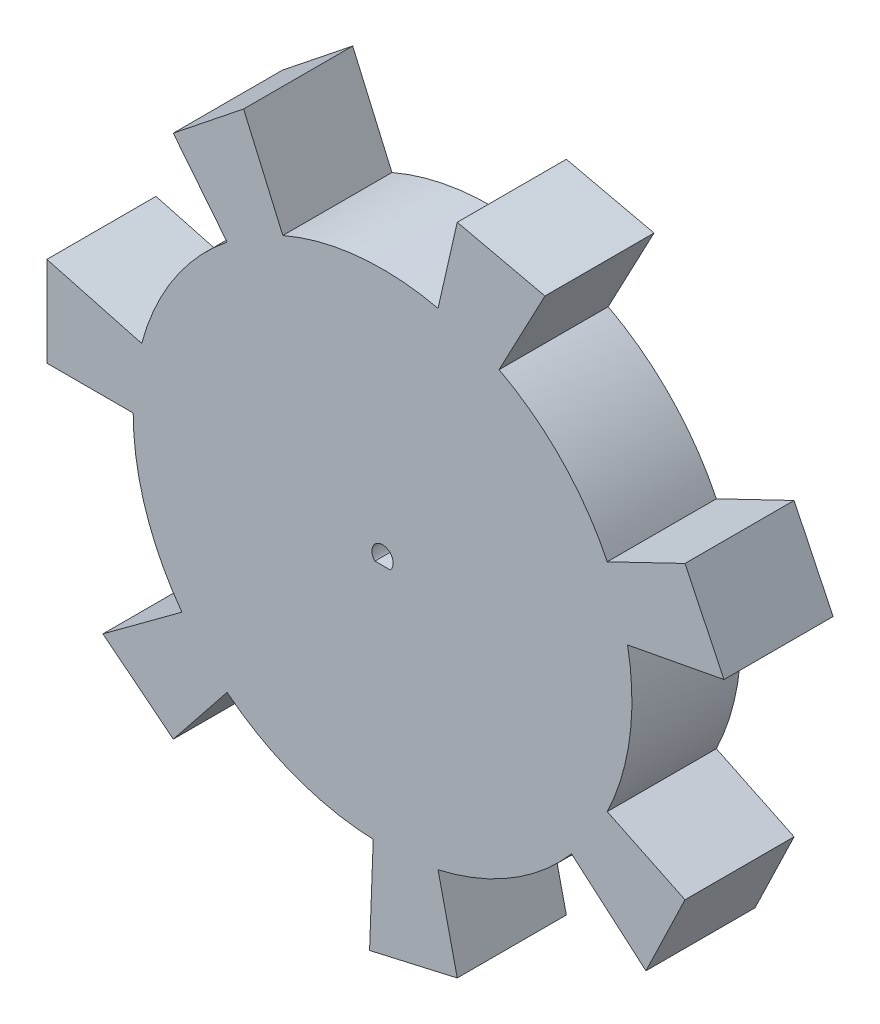
from build123d import *

# Parameters (mm, degrees)
SKETCH1_R           = 40
BOSS_EXTRUDE1_DEPTH = 17.5
SHELL1_OUTLINE_R    = 30
SHELL1_DEPTH        = 7.5
CUT_EXTRUDE1_DEPTH  = 17.5


# Read off the part's stored shape, not the designer's step: Shell1
with BuildPart() as part:
    # Sketch1 → Boss-Extrude1 (new body)
    with BuildSketch(Plane.XY):
        Circle(SKETCH1_R)
        with BuildLine():
            Line((-53.841642229, 0), (-40, 0))
            ThreePointArc((-40, 0), (-39.657794455, 5.221047689), (-38.637033052, 10.352761804))
            Line((-38.637033052, 10.352761804), (-53.841642229, 14.426824554))
            Line((-53.841642229, 14.426824554), (-53.841642229, 0))
        make_face()
        with BuildLine():
            Line((-33.569714845, 42.095090962), (-24.939592074, 31.273259299))
            ThreePointArc((-24.939592074, 31.273259299), (-20.644250952, 34.260982219), (-15.995680973, 36.662490235))
            Line((-15.995680973, 36.662490235), (-22.290369216, 51.090068945))
            Line((-22.290369216, 51.090068945), (-33.569714845, 42.095090962))
        make_face()
        with BuildLine():
            Line((11.980892514, 52.491719847), (8.900837358, 38.997116487))
            ThreePointArc((8.900837358, 38.997116487), (13.914834583, 37.501698342), (18.690745131, 35.36461574))
            Line((18.690745131, 35.36461574), (26.046006457, 49.281449373))
            Line((26.046006457, 49.281449373), (11.980892514, 52.491719847))
        make_face()
        with BuildLine():
            Line((48.509643445, 23.36101305), (36.038754716, 17.355349565))
            ThreePointArc((36.038754716, 17.355349565), (37.995765867, 12.502870718), (39.302658929, 7.436464287))
            Line((39.302658929, 7.436464287), (54.769208026, 10.362893264))
            Line((54.769208026, 10.362893264), (48.509643445, 23.36101305))
        make_face()
        with BuildLine():
            ThreePointArc((36.038754716, -17.355349565), (33.46511048, -21.910873569), (30.318868926, -26.091496451))
            Line((30.318868926, -26.091496451), (42.250078864, -36.359132837))
            Line((42.250078864, -36.359132837), (48.509643445, -23.36101305))
            Line((48.509643445, -23.36101305), (36.038754716, -17.355349565))
        make_face()
        with BuildLine():
            ThreePointArc((8.900837358, -38.997116487), (3.734544338, -39.825283158), (-1.495647771, -39.972028192))
            Line((-1.495647771, -39.972028192), (-2.084221428, -55.70199032))
            Line((-2.084221428, -55.70199032), (11.980892514, -52.491719847))
            Line((11.980892514, -52.491719847), (8.900837358, -38.997116487))
        make_face()
        with BuildLine():
            ThreePointArc((-24.939592074, -31.273259299), (-28.808209861, -27.750442241), (-32.183911191, -23.752807423))
            Line((-32.183911191, -23.752807423), (-44.849060474, -33.100112979))
            Line((-44.849060474, -33.100112979), (-33.569714845, -42.095090962))
            Line((-33.569714845, -42.095090962), (-24.939592074, -31.273259299))
        make_face()
    extrude(amount=BOSS_EXTRUDE1_DEPTH)

    # Shell1 outline → Shell1 (cut)
    with BuildSketch(Plane.XY):
        Circle(SHELL1_OUTLINE_R)
    extrude(amount=SHELL1_DEPTH, mode=Mode.SUBTRACT)

    # Sketch2 → Cut-Extrude1 (cut)
    with BuildSketch(Plane(origin=(0, 0, 0), x_dir=(-1, 0, 0), z_dir=(0, 0, -1))):
        with BuildLine():
            Line((-1.223764683, -1.18), (1.223764683, -1.18))
            ThreePointArc((1.223764683, -1.18), (0, 1.7), (-1.223764683, -1.18))
        make_face()
    extrude(amount=-CUT_EXTRUDE1_DEPTH, mode=Mode.SUBTRACT)


solid = part.part
